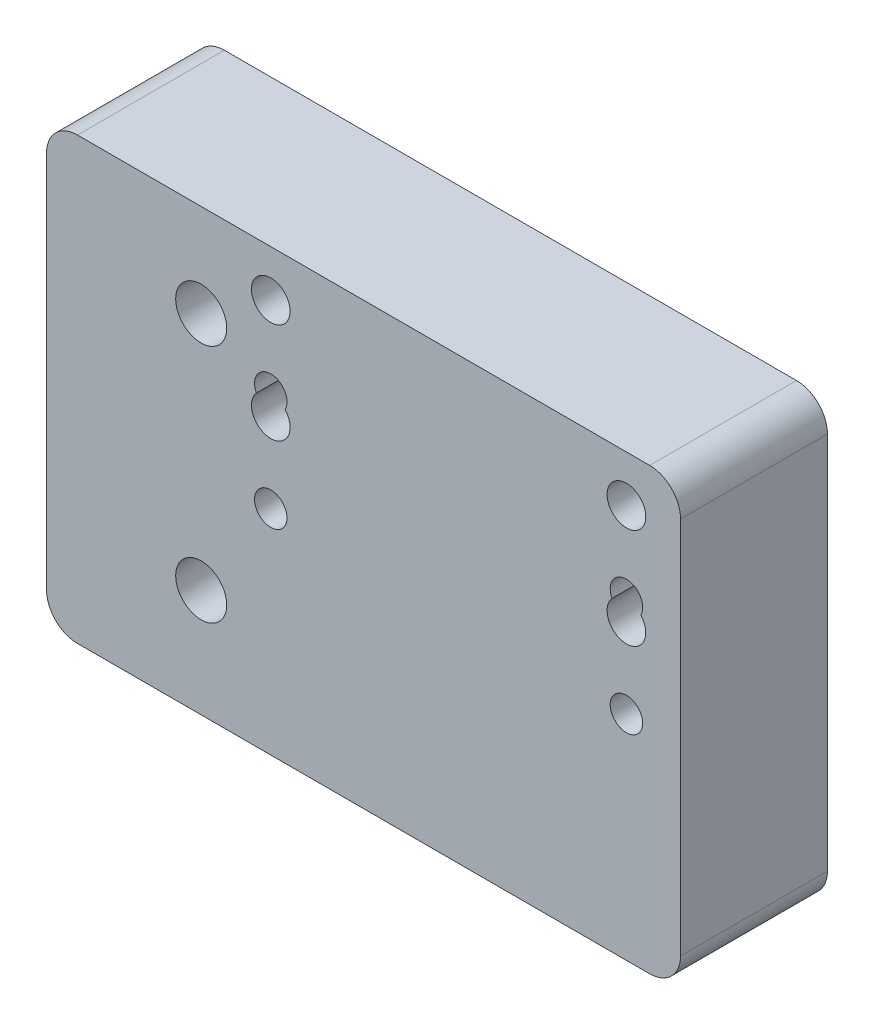
from build123d import *

# Parameters (mm, degrees)
SKETCH1_W                                           = 81.999999998
SKETCH1_H                                           = 60
BOSS_EXTRUDE1_DEPTH                                 = 19
TAP_DRILL_FOR_M6_TAP1_D                             = 5
CSK_FOR_M6_COUNTERSUNK_FLAT_HEAD_SCREW1_D           = 6.6
CSK_FOR_M6_COUNTERSUNK_FLAT_HEAD_SCREW1_CSINK_D     = 12.6
CSK_FOR_M6_COUNTERSUNK_FLAT_HEAD_SCREW1_CSINK_ANGLE = 90
SKETCH7_W                                           = 81.999999998
SKETCH7_H                                           = 4
CUT_EXTRUDE1_DEPTH                                  = 95.50348792
SKETCH10_W                                          = 81.999999998
SKETCH10_H                                          = 0.95
BOSS_EXTRUDE2_DEPTH                                 = 19
FILLET1_R                                           = 4
TAP_DRILL_FOR_M5_TAP1_D                             = 4.2
TAP_DRILL_FOR_M5_TAP1_DEPTH                         = 30
TAP_DRILL_FOR_M5_TAP1_TIP                           = 1.2618073
TAP_DRILL_FOR_M5_TAP2_D                             = 4.2


with BuildPart() as part:
    # Sketch1 → Boss-Extrude1 (new body)
    with BuildSketch(Plane.XY):
        with Locations((20.999999999, 38.745248777)):
            Rectangle(SKETCH1_W, SKETCH1_H)
    extrude(amount=BOSS_EXTRUDE1_DEPTH)

    # Tap Drill for M6 Tap1 (through all)
    with Locations(Plane.XY.offset(19)):
        with Locations((8.999999998, 58.745248777), (54.999999998, 58.745248777), (54.999999998, 45.745248777), (8.999999998, 45.745248777)):
            Hole(TAP_DRILL_FOR_M6_TAP1_D / 2)

    # CSK for M6 Countersunk Flat Head Screw1 (through all)
    with Locations(Plane(origin=(0, 0, 0), x_dir=(1, 0, 0), z_dir=(0, 0, -1))):
        with Locations((0, -21.745248777), (0, -52.745248777)):
            CounterSinkHole(CSK_FOR_M6_COUNTERSUNK_FLAT_HEAD_SCREW1_D / 2, CSK_FOR_M6_COUNTERSUNK_FLAT_HEAD_SCREW1_CSINK_D / 2, counter_sink_angle=CSK_FOR_M6_COUNTERSUNK_FLAT_HEAD_SCREW1_CSINK_ANGLE)

    # Sketch7 → Cut-Extrude1 (cut, through all)
    with BuildSketch(Plane(origin=(0, 0, 0), x_dir=(-1, 0, 0), z_dir=(0, 0, -1))):
        with Locations((-20.999999999, 66.745248777)):
            Rectangle(SKETCH7_W, SKETCH7_H)
    extrude(amount=-CUT_EXTRUDE1_DEPTH, mode=Mode.SUBTRACT)

    # Sketch10 → Boss-Extrude2 (add)
    with BuildSketch(Plane(origin=(0, 0, 0), x_dir=(-1, 0, 0), z_dir=(0, 0, -1))):
        with Locations((-20.999999999, 8.270248777)):
            Rectangle(SKETCH10_W, SKETCH10_H)
    extrude(amount=-BOSS_EXTRUDE2_DEPTH)

    # Fillet1
    fillet1_edges = [part.edges().sort_by_distance(p)[0] for p in [
        (-20, 7.795248777, 9.5),
        (61.999999998, 7.795248777, 9.5),
        (-20, 64.745248777, 9.5),
        (61.999999998, 64.745248777, 9.5),
    ]]
    fillet(fillet1_edges, radius=FILLET1_R)

    # Tap Drill for M5 Tap1
    with Locations(Plane(origin=(0, 7.795248777, 0), x_dir=(-1, 0, 0), z_dir=(0, -1, 0))):
        with Locations((-41.999999998, -9.499999998)):
            Hole(TAP_DRILL_FOR_M5_TAP1_D / 2, depth=TAP_DRILL_FOR_M5_TAP1_DEPTH)
            with Locations((0, 0, -(TAP_DRILL_FOR_M5_TAP1_DEPTH + TAP_DRILL_FOR_M5_TAP1_TIP / 2))):  # 118° drill point
                Cone(0, TAP_DRILL_FOR_M5_TAP1_D / 2, TAP_DRILL_FOR_M5_TAP1_TIP, mode=Mode.SUBTRACT)

    # Tap Drill for M5 Tap2 (through all)
    with Locations(Plane.XY.offset(19)):
        with Locations((54.999999998, 35.395248777), (54.999999998, 48.395248777), (8.999999998, 35.395248777), (8.999999998, 48.395248777)):
            Hole(TAP_DRILL_FOR_M5_TAP2_D / 2)


solid = part.part
